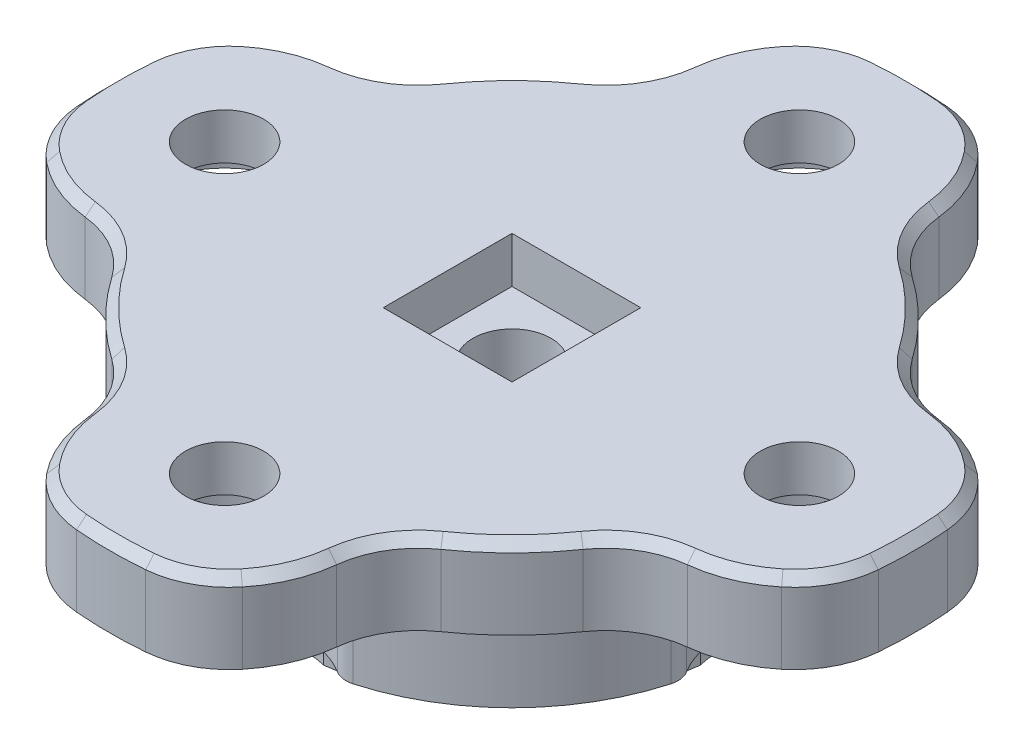
from build123d import *

# Parameters (mm, degrees)
ESQUISSE1_R                  = 10
BOSS_EXTRU_1_DEPTH           = 4
ESQUISSE8_R                  = 11
BOSS_EXTRU_4_DEPTH           = 0.5
ESQUISSE3_R                  = 17.5
ESQUISSE3_R_2                = 1.7
BOSS_EXTRU_2_DEPTH           = 3.5
ENL_V_MAT_EXTRU_2_DEPTH      = 26.154522456
ENL_V_MAT_EXTRU_2_DEPTH_BACK = 1.5
ESQUISSE4_R                  = 3.55
ESQUISSE11_OUTSIDE_W         = 47.028
ESQUISSE11_OUTSIDE_H         = 47.028
ENL_V_MAT_EXTRU_3_DEPTH      = 27.009613607
CONG_1_R                     = 4
CONG_2_R                     = 1
CHANFREIN2_SIZE              = 0.4
ESQUISSE12_R                 = 1.7
ENL_V_MAT_EXTRU_4_DEPTH      = 27.009613773
ESQUISSE13_W                 = 5.6
ESQUISSE13_H                 = 5.6
ENL_V_MAT_EXTRU_5_DEPTH      = 2
BOSS_EXTRU_5_START           = 0.5
ESQUISSE14_R                 = 9.1
ESQUISSE14_R_2               = 1.7
BOSS_EXTRU_5_DEPTH           = 0.5
ESQUISSE15_R                 = 3.55
ENL_V_MAT_EXTRU_6_DEPTH      = 0.5


with BuildPart() as part:
    # Esquisse1 → Boss.-Extru.1 (new body)
    with BuildSketch(Plane(origin=(0, 0, 0), x_dir=(1, 0, 0), z_dir=(0, 1, 0))):
        Circle(ESQUISSE1_R)
    extrude(amount=BOSS_EXTRU_1_DEPTH)

    # Esquisse8 → Boss.-Extru.4 (add)
    with BuildSketch(Plane(origin=(0, 4, 0), x_dir=(1, 0, 0), z_dir=(0, 1, 0))):
        Circle(ESQUISSE8_R)
    extrude(amount=BOSS_EXTRU_4_DEPTH)

    # Esquisse3 → Boss.-Extru.2 (add)
    with BuildSketch(Plane(origin=(0, 4.5, 0), x_dir=(1, 0, 0), z_dir=(0, 1, 0))):
        Circle(ESQUISSE3_R)
        with Locations((-12.5, 0)):
            Circle(ESQUISSE3_R_2, mode=Mode.SUBTRACT)
        with Locations((0, 12.5)):
            Circle(ESQUISSE3_R_2, mode=Mode.SUBTRACT)
        with Locations((12.5, 0)):
            Circle(ESQUISSE3_R_2, mode=Mode.SUBTRACT)
        with Locations((0, -12.5)):
            Circle(ESQUISSE3_R_2, mode=Mode.SUBTRACT)
    extrude(amount=BOSS_EXTRU_2_DEPTH)

    # Esquisse4 → Enlèv. mat.-Extru.2 (cut, two sides: drawn at the far end of the back side and taken through both)
    with BuildSketch(Plane.XZ.offset(-4.5).offset(-ENL_V_MAT_EXTRU_2_DEPTH_BACK)):
        with Locations((0, -12.5)):
            Circle(ESQUISSE4_R)
        with Locations((-12.5, 0)):
            Circle(ESQUISSE4_R)
        with Locations((0, 12.5)):
            Circle(ESQUISSE4_R)
        with Locations((12.5, 0)):
            Circle(ESQUISSE4_R)
    extrude(amount=ENL_V_MAT_EXTRU_2_DEPTH + ENL_V_MAT_EXTRU_2_DEPTH_BACK, mode=Mode.SUBTRACT)

    # Esquisse11 outside → Enlèv. mat.-Extru.3 (cut, through all)
    with BuildSketch(Plane(origin=(0, 8, 0), x_dir=(1, 0, 0), z_dir=(0, 1, 0))):
        Rectangle(ESQUISSE11_OUTSIDE_W, ESQUISSE11_OUTSIDE_H)
        with BuildLine():
            ThreePointArc((-5.365249295, -11.29), (0, -18), (5.365249295, -11.29))
            ThreePointArc((5.365249295, -11.29), (8.838834765, -8.838834765), (11.29, -5.365249295))
            ThreePointArc((11.29, -5.365249295), (18, 0), (11.29, 5.365249295))
            ThreePointArc((11.29, 5.365249295), (8.838834765, 8.838834765), (5.365249295, 11.29))
            ThreePointArc((5.365249295, 11.29), (0, 18), (-5.365249295, 11.29))
            ThreePointArc((-5.365249295, 11.29), (-8.838834765, 8.838834765), (-11.29, 5.365249295))
            ThreePointArc((-11.29, 5.365249295), (-18, 0), (-11.29, -5.365249295))
            ThreePointArc((-11.29, -5.365249295), (-8.838834765, -8.838834765), (-5.365249295, -11.29))
        make_face(mode=Mode.SUBTRACT)
    extrude(amount=-ENL_V_MAT_EXTRU_3_DEPTH, mode=Mode.SUBTRACT)

    # Congé1
    cong_1_edges = [part.edges().sort_by_distance(p)[0] for p in [
        (-11.29, 6.25, -5.365249295),
        (-5.365249295, 6.25, -11.29),
        (5.365249295, 6.25, -11.29),
        (11.29, 6.25, -5.365249295),
        (11.29, 6.25, 5.365249295),
        (5.365249295, 6.25, 11.29),
        (-11.29, 6.25, 5.365249295),
        (-5.365249295, 6.25, 11.29),
        (-17.29, 6.25, -2.702942841),
        (-17.29, 6.25, 2.702942841),
        (-2.702942841, 6.25, -17.29),
        (2.702942841, 6.25, -17.29),
        (17.29, 6.25, -2.702942841),
        (17.29, 6.25, 2.702942841),
        (-2.702942841, 6.25, 17.29),
        (2.702942841, 6.25, 17.29),
    ]]
    fillet(cong_1_edges, radius=CONG_1_R)

    # Congé2
    cong_2_edges = [part.edges().sort_by_distance(p)[0] for p in [
        (2.239962765, 2, 9.7459),
        (-2.239962765, 2, 9.7459),
        (-9.7459, 2, 2.239962765),
        (-9.7459, 2, -2.239962765),
        (-2.239962765, 2, -9.7459),
        (2.239962765, 2, -9.7459),
        (9.7459, 2, 2.239962765),
        (9.7459, 2, -2.239962765),
    ]]
    fillet(cong_2_edges, radius=CONG_2_R)

    # Chanfrein2
    chanfrein2_edges = [part.edges().sort_by_distance(p)[0] for p in [
        (3.027485343, 8, -16.98773311),
        (0, 8, -17.5),
        (5.071719486, 8, -14.627830223),
        (-3.027485343, 8, -16.98773311),
        (6.002970096, 8, -11.490557352),
        (-5.071719486, 8, -14.627830223),
        (8.838834765, 8, -8.838834765),
        (-6.002970096, 8, -11.490557352),
        (11.490557352, 8, -6.002970096),
        (-8.838834765, 8, -8.838834765),
        (14.627830223, 8, -5.071719486),
        (-11.490557352, 8, -6.002970096),
        (16.98773311, 8, -3.027485343),
        (-14.627830223, 8, -5.071719486),
        (17.5, 8, 0),
        (-16.98773311, 8, -3.027485343),
        (16.98773311, 8, 3.027485343),
        (-17.5, 8, 0),
        (14.627830223, 8, 5.071719486),
        (-16.98773311, 8, 3.027485343),
        (11.490557352, 8, 6.002970096),
        (-14.627830223, 8, 5.071719486),
        (8.838834765, 8, 8.838834765),
        (-11.490557352, 8, 6.002970096),
        (6.002970096, 8, 11.490557352),
        (-8.838834765, 8, 8.838834765),
        (5.071719486, 8, 14.627830223),
        (-6.002970096, 8, 11.490557352),
        (3.027485343, 8, 16.98773311),
        (-5.071719486, 8, 14.627830223),
        (0, 8, 17.5),
        (-3.027485343, 8, 16.98773311),
    ]]
    chamfer(chanfrein2_edges, length=CHANFREIN2_SIZE)

    # Esquisse12 → Enlèv. mat.-Extru.4 (cut, through all)
    with BuildSketch(Plane.XZ):
        Circle(ESQUISSE12_R)
    extrude(amount=-ENL_V_MAT_EXTRU_4_DEPTH, mode=Mode.SUBTRACT)

    # Esquisse13 → Enlèv. mat.-Extru.5 (cut)
    with BuildSketch(Plane(origin=(0, 8, 0), x_dir=(1, 0, 0), z_dir=(0, 1, 0))):
        Rectangle(ESQUISSE13_W, ESQUISSE13_H)
    extrude(amount=-ENL_V_MAT_EXTRU_5_DEPTH, mode=Mode.SUBTRACT)

    # Esquisse14 → Boss.-Extru.5 (add)
    with BuildSketch(Plane.XZ.offset(BOSS_EXTRU_5_START)):
        Circle(ESQUISSE14_R)
        Circle(ESQUISSE14_R_2, mode=Mode.SUBTRACT)
    extrude(amount=-BOSS_EXTRU_5_DEPTH)

    # Esquisse15 → Enlèv. mat.-Extru.6 (cut)
    with BuildSketch(Plane.XZ.offset(0.5)):
        with Locations((12.5, 0)):
            Circle(ESQUISSE15_R)
        with Locations((0, 12.5)):
            Circle(ESQUISSE15_R)
        with Locations((-12.5, 0)):
            Circle(ESQUISSE15_R)
        with Locations((0, -12.5)):
            Circle(ESQUISSE15_R)
    extrude(amount=-ENL_V_MAT_EXTRU_6_DEPTH, mode=Mode.SUBTRACT)


solid = part.part
